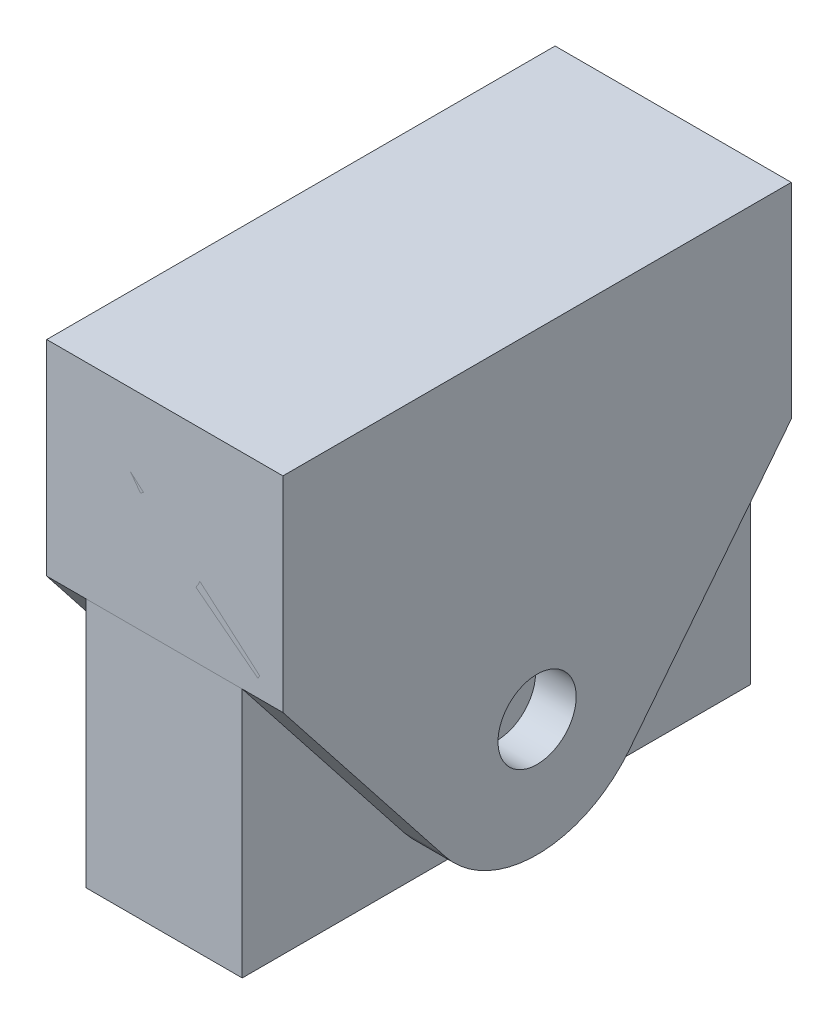
from build123d import *

# Parameters (mm, degrees)
BOSS_EXTRUDE1_DEPTH      = 5.159375
BOSS_EXTRUDE1_DEPTH_BACK = 5.159375
SKETCH1_R                = 0.79375
BOSS_EXTRUDE2_DEPTH      = 4.0005
BOSS_EXTRUDE2_DEPTH_BACK = 0.79375
SKETCH2_R                = 0.79375


with BuildPart() as part:
    # Sketch1 → Boss-Extrude1 (new, two sides: drawn at the far end of the back side and taken through both)
    with BuildSketch(Plane.XY.offset(-BOSS_EXTRUDE1_DEPTH_BACK)):
        with BuildLine():
            Line((0, 0), (0, 5.083121043))
            ThreePointArc((0, 5.083121043), (1.5875, 9.23925), (3.175, 5.083121043))
            Line((3.175, 5.083121043), (3.175, 0))
            Line((3.175, 0), (0, 0))
        make_face()
        with Locations((1.5875, 6.858)):
            Circle(SKETCH1_R, mode=Mode.SUBTRACT)
    extrude(amount=BOSS_EXTRUDE1_DEPTH + BOSS_EXTRUDE1_DEPTH_BACK)


with BuildPart() as body_2:
    # Sketch2 → Boss-Extrude2 (new, two sides: drawn at the far end of the back side and taken through both)
    with BuildSketch(Plane(origin=(0, 0, 0), x_dir=(0, 0, -1), z_dir=(1, 0, 0)).offset(-BOSS_EXTRUDE2_DEPTH_BACK)):
        with BuildLine():
            Line((-1.870115083, 0.907132929), (-5.159375, 5.08))
            Line((-5.159375, 5.08), (-5.159375, 9.23925))
            Line((-5.159375, 9.23925), (5.159375, 9.23925))
            Line((5.159375, 9.23925), (5.159375, 5.08))
            Line((5.159375, 5.08), (1.870115083, 0.907132929))
            ThreePointArc((1.870115083, 0.907132929), (0, 0), (-1.870115083, 0.907132929))
        make_face()
        with Locations((0, 2.38125)):
            Circle(SKETCH2_R, mode=Mode.SUBTRACT)
    extrude(amount=BOSS_EXTRUDE2_DEPTH + BOSS_EXTRUDE2_DEPTH_BACK)


solid = Compound([part.part, body_2.part])
